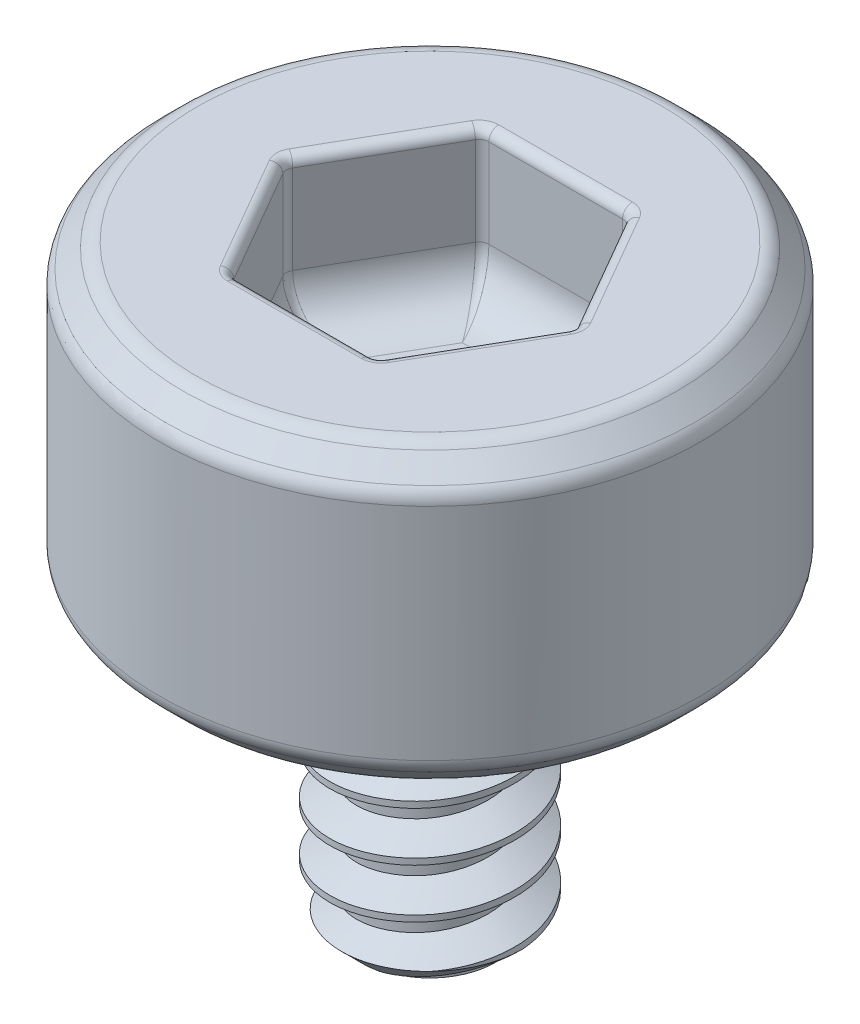
from build123d import *

# Parameters (mm, degrees)
SKETCH8_W          = 0.9375
SKETCH8_H          = 6
CHAMFER1_SIZE      = 0.25
THREAD2_PITCH      = 0.5
SKETCH13_W         = 2.75
SKETCH13_H         = 3
CHAMFER2_SIZE      = 0.3
FILLET1_R          = 0.2
CUT_EXTRUDE1_DEPTH = 1.5
FILLET2_R          = 0.5
FILLET3_R          = 0.1


with BuildPart() as part:
    # Sketch8 → Revolve1 (revolve)
    with BuildSketch(Plane.XY, mode=Mode.PRIVATE) as revolve1_sk:
        with Locations((0.46875, -3)):
            Rectangle(SKETCH8_W, SKETCH8_H)
    revolve(revolve1_sk.sketch.rotate(Axis((0, 0, 0), (0, -1, 0)), 180), axis=Axis((0, 0, 0), (0, -1, 0)))

    # Chamfer1
    chamfer1_edges = [part.edges().sort_by_distance(p)[0] for p in [
        (0.9375, -6, 0),
    ]]
    chamfer(chamfer1_edges, length=CHAMFER1_SIZE)

    # Thread2: the profile of Thread Profile2 profile screwed along a right-hand helix of 20 turns, 6 arcs to a turn; built about Z, then put on its axis
    thread2_z = Axis((0, 0, 0), (0, 0, 1))
    thread2_corners = [(0.9378, 0, 0.437673207), (0.9378, 0, -0.000173205), (0.66686706, 0, 0.156250001), (0.66686706, 0, 0.281250001)]
    with BuildLine(mode=Mode.PRIVATE) as thread2_profile:
        Line(thread2_corners[0], thread2_corners[1])
        Line(thread2_corners[1], thread2_corners[2])
        Line(thread2_corners[2], thread2_corners[3])
        Line(thread2_corners[3], thread2_corners[0])
    thread2_cap = Face(thread2_profile.wire())
    thread2_turn_angles = [0, 30, 60, 90, 120, 150, 180, 210, 240, 270, 300, 330, 360]
    thread2_turn_weights = [1, 0.8660254037844387, 1, 0.8660254037844387, 1, 0.8660254037844387, 1, 0.8660254037844387, 1, 0.8660254037844387, 1, 0.8660254037844387, 1]
    thread2_turn_rails = [Edge.make_bspline([Vector(p[0], p[1], 0).rotate(thread2_z, thread2_turn_angles[k]) / thread2_turn_weights[k] + Vector(0, 0, p[2] + THREAD2_PITCH * thread2_turn_angles[k] / 360) for k in range(13)], [0, 0, 0, 1, 1, 2, 2, 3, 3, 4, 4, 5, 5, 6, 6, 6], 2, thread2_turn_weights) for p in thread2_corners]
    thread2_turn_sides = [Face.make_surface_from_curves(thread2_turn_rails[p[0]], thread2_turn_rails[p[1]]) for p in [(0, 1), (1, 2), (2, 3), (3, 0)]]
    thread2 = Plane(origin=(0, 0, 0), x_dir=(-1, 0, 0), z_dir=(0, -1, 0)) * Solid(Shell([*[p.moved(Location((0, 0, THREAD2_PITCH * i))) for i in range(20) for p in thread2_turn_sides], thread2_cap, thread2_cap.rotate(thread2_z, 7200).moved(Location((0, 0, THREAD2_PITCH * 7200 / 360)))]))
    add(thread2, mode=Mode.SUBTRACT)

    # Sketch13 → Revolve2 (revolve)
    with BuildSketch(Plane.XY, mode=Mode.PRIVATE) as revolve2_sk:
        with Locations((1.375, -1.5)):
            Rectangle(SKETCH13_W, SKETCH13_H)
    revolve(revolve2_sk.sketch.rotate(Axis((0, 0, 0), (0, -1, 0)), 180), axis=Axis((0, 0, 0), (0, -1, 0)))

    # Chamfer2
    chamfer2_edges = [part.edges().sort_by_distance(p)[0] for p in [
        (2.75, 0, 0),
        (2.75, -3, 0),
    ]]
    chamfer(chamfer2_edges, length=CHAMFER2_SIZE)

    # Fillet1
    fillet1_edges = [part.edges().sort_by_distance(p)[0] for p in [
        (2.45, 0, 0),
        (2.75, -2.7, 0),
        (2.75, -0.3, 0),
        (2.45, -3, 0),
    ]]
    fillet(fillet1_edges, radius=FILLET1_R)

    # Sketch14 → Cut-Extrude1 (cut)
    with BuildSketch(Plane(origin=(0, 0, 0), x_dir=(1, 0, 0), z_dir=(0, 1, 0))):
        Polygon((1.472243186, 0), (0.736121593, 1.275), (-0.736121593, 1.275), (-1.472243186, 0), (-0.736121593, -1.275), (0.736121593, -1.275), align=None)
    extrude(amount=-CUT_EXTRUDE1_DEPTH, mode=Mode.SUBTRACT)

    # Fillet2
    fillet2_edges = [part.edges().sort_by_distance(p)[0] for p in [
        (1.10418239, -1.5, 0.6375),
        (0, -1.5, 1.275),
        (-1.10418239, -1.5, 0.6375),
        (-1.10418239, -1.5, -0.6375),
        (0, -1.5, -1.275),
        (1.10418239, -1.5, -0.6375),
    ]]
    fillet(fillet2_edges, radius=FILLET2_R)

    # Fillet3
    fillet3_edges = [part.edges().sort_by_distance(p)[0] for p in [
        (1.10418239, 0, 0.6375),
        (1.10418239, 0, -0.6375),
        (0, 0, -1.275),
        (-1.10418239, 0, -0.6375),
        (-1.10418239, 0, 0.6375),
        (0, 0, 1.275),
        (0.736121593, -0.5, 1.275),
        (-0.736121593, -0.5, 1.275),
        (-1.472243186, -0.5, 0),
        (-0.736121593, -0.5, -1.275),
        (0.736121593, -0.5, -1.275),
        (1.472243186, -0.5, 0),
        (-0.644158089, -1.365942076, -1.115714539),
        (0.644158089, -1.365942076, -1.115714539),
        (-1.288316179, -1.365942076, 0),
        (1.288316179, -1.365942076, 0),
        (-0.644158089, -1.365942076, 1.115714539),
        (0.644158089, -1.365942076, 1.115714539),
    ]]
    fillet(fillet3_edges, radius=FILLET3_R)


solid = part.part
